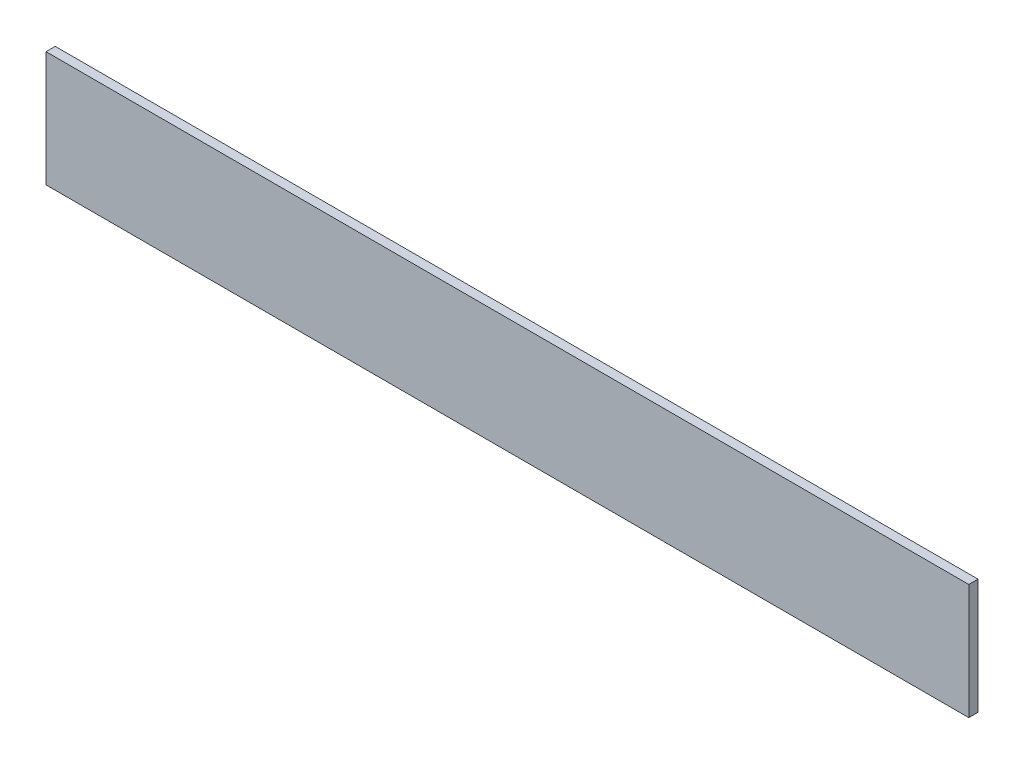
from build123d import *

# Parameters (mm, degrees)
EXTRUDE_1_DEPTH     = 200
SKETCH_2_W          = 23
SKETCH_2_H          = 23
CUT_EXTRUDE_1_DEPTH = 204.100960116


with BuildPart() as part:
    # Эскиз1 → Вытянуть-Тонкостенный1 (new body)
    with BuildSketch(Plane(origin=(0, 0, 0), x_dir=(0, 0, -1), z_dir=(1, 0, 0))):
        Polygon((0, 25), (0, 0), (25, 0), (25, 2), (2, 2), (2, 25), align=None)
    extrude(amount=EXTRUDE_1_DEPTH)

    # Эскиз2 → Вырез-Вытянуть1 (cut, through all)
    with BuildSketch(Plane.XZ):
        with Locations((188.5, -13.5)):
            Rectangle(SKETCH_2_W, SKETCH_2_H)
    extrude(amount=-CUT_EXTRUDE_1_DEPTH, mode=Mode.SUBTRACT)


solid = part.part
